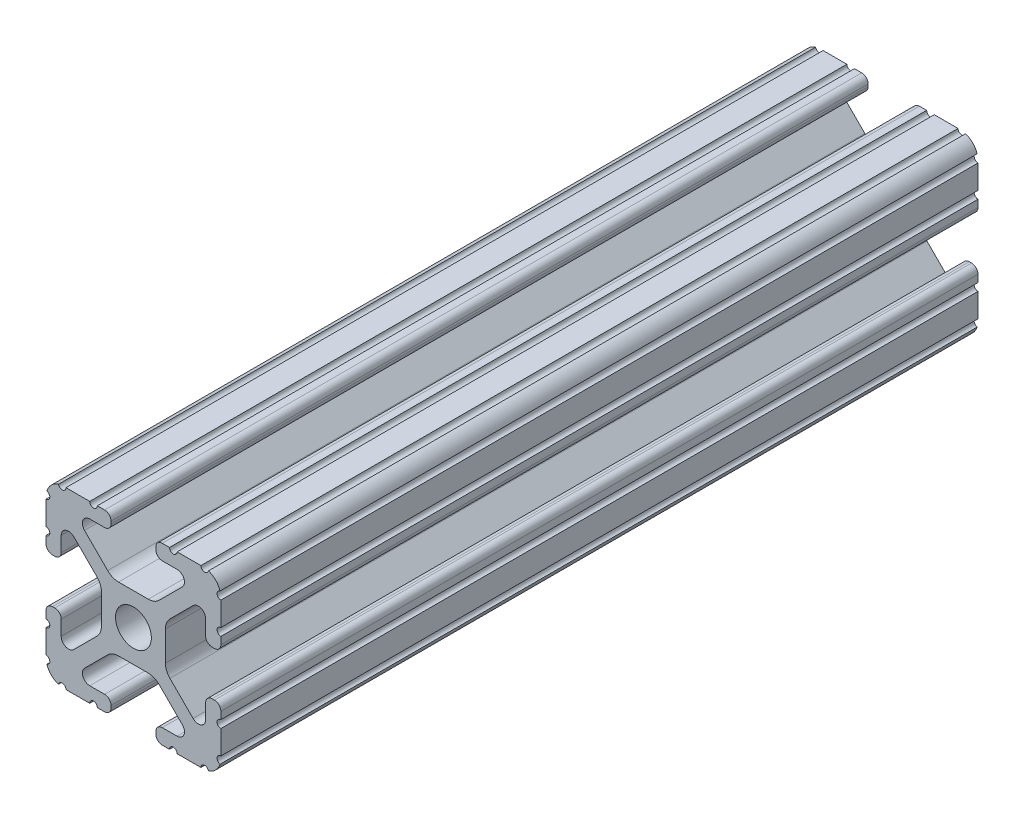
from build123d import *

# Parameters (mm, degrees)
BOSS_EXTRUDE1_DEPTH     = 76.2
CUT_EXTRUDE1_DEPTH      = 79.288057838
CUT_EXTRUDE1_DEPTH_BACK = 79.288057838
SKETCH5_R               = 0.55245
SKETCH6_R               = 2.6035
CUT_EXTRUDE3_DEPTH      = 42.418


with BuildPart() as part:
    # Sketch4 → Boss-Extrude1 (new, symmetric)
    with BuildSketch(Plane.XY):
        with BuildLine():
            Line((4.190365, -12.7), (10.11729625, -12.7))
            ThreePointArc((10.11729625, -12.7), (11.943543585, -11.943543585), (12.7, -10.11729625))
            Line((12.7, -10.11729625), (12.7, -4.190365))
            ThreePointArc((12.7, -4.190365), (12.42492494, -3.52627506), (11.760835, -3.2512))
            Line((11.760835, -3.2512), (11.429365, -3.2512))
            ThreePointArc((11.429365, -3.2512), (10.76527506, -3.52627506), (10.4902, -4.190365))
            Line((10.4902, -4.190365), (10.4902, -6.348478019))
            ThreePointArc((10.4902, -6.348478019), (9.830707141, -7.335478831), (8.666460301, -7.103895736))
            Line((8.666460301, -7.103895736), (5.299899128, -3.737334563))
            ThreePointArc((5.299899128, -3.737334563), (4.817571085, -3.015479634), (4.6482, -2.16399369))
            Line((4.6482, -2.16399369), (4.6482, 0))
            Line((4.6482, 0), (2.6035, 0))
            ThreePointArc((2.6035, 0), (1.840952505, -1.840952505), (0, -2.6035))
            Line((0, -2.6035), (0, -4.6482))
            Line((0, -4.6482), (2.16399369, -4.6482))
            ThreePointArc((2.16399369, -4.6482), (3.015479634, -4.817571085), (3.737334563, -5.299899128))
            Line((3.737334563, -5.299899128), (7.103895736, -8.666460301))
            ThreePointArc((7.103895736, -8.666460301), (7.335478831, -9.830707141), (6.348478019, -10.4902))
            Line((6.348478019, -10.4902), (4.190365, -10.4902))
            ThreePointArc((4.190365, -10.4902), (3.52627506, -10.76527506), (3.2512, -11.429365))
            Line((3.2512, -11.429365), (3.2512, -11.760835))
            ThreePointArc((3.2512, -11.760835), (3.52627506, -12.42492494), (4.190365, -12.7))
        make_face()
    extrude(amount=BOSS_EXTRUDE1_DEPTH, both=True)

    # Sketch5 → Cut-Extrude1 (cut, two sides: drawn at the far end of the back side and taken through both)
    with BuildSketch(Plane.XY.offset(-CUT_EXTRUDE1_DEPTH_BACK)):
        with Locations((10.356153152, -12.7)):
            Circle(SKETCH5_R)
        with Locations((5.796028019, -12.7)):
            Circle(SKETCH5_R)
        with Locations((12.7, -10.356153152)):
            Circle(SKETCH5_R)
        with Locations((12.7, -5.796028019)):
            Circle(SKETCH5_R)
    extrude(amount=CUT_EXTRUDE1_DEPTH + CUT_EXTRUDE1_DEPTH_BACK, mode=Mode.SUBTRACT)

    # Mirror1: part across plane


with BuildPart() as part_1:
    add(part.part)
    add(part.part.mirror(Plane(origin=(0, 0, 0), x_dir=(0, 0, 1), z_dir=(1, 0, 0))))

    # Mirror2: part across plane


with BuildPart() as part_2:
    add(part_1.part)
    add(part_1.part.mirror(Plane.ZX))

    # Sketch6 → Cut-Extrude3 (cut)
    with BuildSketch(Plane.XY.offset(76.2)):
        with BuildLine():
            Line((12.7, -5.243578019), (12.7, -4.190365))
            ThreePointArc((12.7, -4.190365), (12.42492494, -3.52627506), (11.760835, -3.2512))
            Line((11.760835, -3.2512), (11.429365, -3.2512))
            ThreePointArc((11.429365, -3.2512), (10.76527506, -3.52627506), (10.4902, -4.190365))
            Line((10.4902, -4.190365), (10.4902, -6.348478019))
            ThreePointArc((10.4902, -6.348478019), (9.830707141, -7.335478831), (8.666460301, -7.103895736))
            Line((8.666460301, -7.103895736), (5.299899128, -3.737334563))
            ThreePointArc((5.299899128, -3.737334563), (4.817571085, -3.015479634), (4.6482, -2.16399369))
            Line((4.6482, -2.16399369), (4.6482, 2.16399369))
            ThreePointArc((4.6482, 2.16399369), (4.817571085, 3.015479634), (5.299899128, 3.737334563))
            Line((5.299899128, 3.737334563), (8.666460301, 7.103895736))
            ThreePointArc((8.666460301, 7.103895736), (9.830707141, 7.335478831), (10.4902, 6.348478019))
            Line((10.4902, 6.348478019), (10.4902, 4.190365))
            ThreePointArc((10.4902, 4.190365), (10.76527506, 3.52627506), (11.429365, 3.2512))
            Line((11.429365, 3.2512), (11.760835, 3.2512))
            ThreePointArc((11.760835, 3.2512), (12.42492494, 3.52627506), (12.7, 4.190365))
            Line((12.7, 4.190365), (12.7, 5.243578019))
            ThreePointArc((12.7, 5.243578019), (12.14755, 5.796028019), (12.7, 6.348478019))
            Line((12.7, 6.348478019), (12.7, 9.803703152))
            ThreePointArc((12.7, 9.803703152), (12.150857656, 10.295790178), (12.579996867, 10.895412135))
            ThreePointArc((12.579996867, 10.895412135), (11.943543585, 11.943543585), (10.895412135, 12.579996867))
            ThreePointArc((10.895412135, 12.579996867), (10.295790178, 12.150857656), (9.803703152, 12.7))
            Line((9.803703152, 12.7), (6.348478019, 12.7))
            ThreePointArc((6.348478019, 12.7), (5.796028019, 12.14755), (5.243578019, 12.7))
            Line((5.243578019, 12.7), (4.190365, 12.7))
            ThreePointArc((4.190365, 12.7), (3.52627506, 12.42492494), (3.2512, 11.760835))
            Line((3.2512, 11.760835), (3.2512, 11.429365))
            ThreePointArc((3.2512, 11.429365), (3.52627506, 10.76527506), (4.190365, 10.4902))
            Line((4.190365, 10.4902), (6.348478019, 10.4902))
            ThreePointArc((6.348478019, 10.4902), (7.335478831, 9.830707141), (7.103895736, 8.666460301))
            Line((7.103895736, 8.666460301), (3.737334563, 5.299899128))
            ThreePointArc((3.737334563, 5.299899128), (3.015479634, 4.817571085), (2.16399369, 4.6482))
            Line((2.16399369, 4.6482), (-2.16399369, 4.6482))
            ThreePointArc((-2.16399369, 4.6482), (-3.015479634, 4.817571085), (-3.737334563, 5.299899128))
            Line((-3.737334563, 5.299899128), (-7.103895736, 8.666460301))
            ThreePointArc((-7.103895736, 8.666460301), (-7.335478831, 9.830707141), (-6.348478019, 10.4902))
            Line((-6.348478019, 10.4902), (-4.190365, 10.4902))
            ThreePointArc((-4.190365, 10.4902), (-3.52627506, 10.76527506), (-3.2512, 11.429365))
            Line((-3.2512, 11.429365), (-3.2512, 11.760835))
            ThreePointArc((-3.2512, 11.760835), (-3.52627506, 12.42492494), (-4.190365, 12.7))
            Line((-4.190365, 12.7), (-5.243578019, 12.7))
            ThreePointArc((-5.243578019, 12.7), (-5.796028019, 12.14755), (-6.348478019, 12.7))
            Line((-6.348478019, 12.7), (-9.803703152, 12.7))
            ThreePointArc((-9.803703152, 12.7), (-10.295790178, 12.150857656), (-10.895412135, 12.579996867))
            ThreePointArc((-10.895412135, 12.579996867), (-11.943543585, 11.943543585), (-12.579996867, 10.895412135))
            ThreePointArc((-12.579996867, 10.895412135), (-12.150857656, 10.295790178), (-12.7, 9.803703152))
            Line((-12.7, 9.803703152), (-12.7, 6.348478019))
            ThreePointArc((-12.7, 6.348478019), (-12.14755, 5.796028019), (-12.7, 5.243578019))
            Line((-12.7, 5.243578019), (-12.7, 4.190365))
            ThreePointArc((-12.7, 4.190365), (-12.42492494, 3.52627506), (-11.760835, 3.2512))
            Line((-11.760835, 3.2512), (-11.429365, 3.2512))
            ThreePointArc((-11.429365, 3.2512), (-10.76527506, 3.52627506), (-10.4902, 4.190365))
            Line((-10.4902, 4.190365), (-10.4902, 6.348478019))
            ThreePointArc((-10.4902, 6.348478019), (-9.830707141, 7.335478831), (-8.666460301, 7.103895736))
            Line((-8.666460301, 7.103895736), (-5.299899128, 3.737334563))
            ThreePointArc((-5.299899128, 3.737334563), (-4.817571085, 3.015479634), (-4.6482, 2.16399369))
            Line((-4.6482, 2.16399369), (-4.6482, -2.16399369))
            ThreePointArc((-4.6482, -2.16399369), (-4.817571085, -3.015479634), (-5.299899128, -3.737334563))
            Line((-5.299899128, -3.737334563), (-8.666460301, -7.103895736))
            ThreePointArc((-8.666460301, -7.103895736), (-9.830707141, -7.335478831), (-10.4902, -6.348478019))
            Line((-10.4902, -6.348478019), (-10.4902, -4.190365))
            ThreePointArc((-10.4902, -4.190365), (-10.76527506, -3.52627506), (-11.429365, -3.2512))
            Line((-11.429365, -3.2512), (-11.760835, -3.2512))
            ThreePointArc((-11.760835, -3.2512), (-12.42492494, -3.52627506), (-12.7, -4.190365))
            Line((-12.7, -4.190365), (-12.7, -5.243578019))
            ThreePointArc((-12.7, -5.243578019), (-12.14755, -5.796028019), (-12.7, -6.348478019))
            Line((-12.7, -6.348478019), (-12.7, -9.803703152))
            ThreePointArc((-12.7, -9.803703152), (-12.150857656, -10.295790178), (-12.579996867, -10.895412135))
            ThreePointArc((-12.579996867, -10.895412135), (-11.943543585, -11.943543585), (-10.895412135, -12.579996867))
            ThreePointArc((-10.895412135, -12.579996867), (-10.295790178, -12.150857656), (-9.803703152, -12.7))
            Line((-9.803703152, -12.7), (-6.348478019, -12.7))
            ThreePointArc((-6.348478019, -12.7), (-5.796028019, -12.14755), (-5.243578019, -12.7))
            Line((-5.243578019, -12.7), (-4.190365, -12.7))
            ThreePointArc((-4.190365, -12.7), (-3.52627506, -12.42492494), (-3.2512, -11.760835))
            Line((-3.2512, -11.760835), (-3.2512, -11.429365))
            ThreePointArc((-3.2512, -11.429365), (-3.52627506, -10.76527506), (-4.190365, -10.4902))
            Line((-4.190365, -10.4902), (-6.348478019, -10.4902))
            ThreePointArc((-6.348478019, -10.4902), (-7.335478831, -9.830707141), (-7.103895736, -8.666460301))
            Line((-7.103895736, -8.666460301), (-3.737334563, -5.299899128))
            ThreePointArc((-3.737334563, -5.299899128), (-3.015479634, -4.817571085), (-2.16399369, -4.6482))
            Line((-2.16399369, -4.6482), (2.16399369, -4.6482))
            ThreePointArc((2.16399369, -4.6482), (3.015479634, -4.817571085), (3.737334563, -5.299899128))
            Line((3.737334563, -5.299899128), (7.103895736, -8.666460301))
            ThreePointArc((7.103895736, -8.666460301), (7.335478831, -9.830707141), (6.348478019, -10.4902))
            Line((6.348478019, -10.4902), (4.190365, -10.4902))
            ThreePointArc((4.190365, -10.4902), (3.52627506, -10.76527506), (3.2512, -11.429365))
            Line((3.2512, -11.429365), (3.2512, -11.760835))
            ThreePointArc((3.2512, -11.760835), (3.52627506, -12.42492494), (4.190365, -12.7))
            Line((4.190365, -12.7), (5.243578019, -12.7))
            ThreePointArc((5.243578019, -12.7), (5.796028019, -12.14755), (6.348478019, -12.7))
            Line((6.348478019, -12.7), (9.803703152, -12.7))
            ThreePointArc((9.803703152, -12.7), (10.295790178, -12.150857656), (10.895412135, -12.579996867))
            ThreePointArc((10.895412135, -12.579996867), (11.943543585, -11.943543585), (12.579996867, -10.895412135))
            ThreePointArc((12.579996867, -10.895412135), (12.150857656, -10.295790178), (12.7, -9.803703152))
            Line((12.7, -9.803703152), (12.7, -6.348478019))
            ThreePointArc((12.7, -6.348478019), (12.14755, -5.796028019), (12.7, -5.243578019))
        make_face()
        Circle(SKETCH6_R, mode=Mode.SUBTRACT)
    extrude(amount=-CUT_EXTRUDE3_DEPTH, mode=Mode.SUBTRACT)


solid = part_2.part
